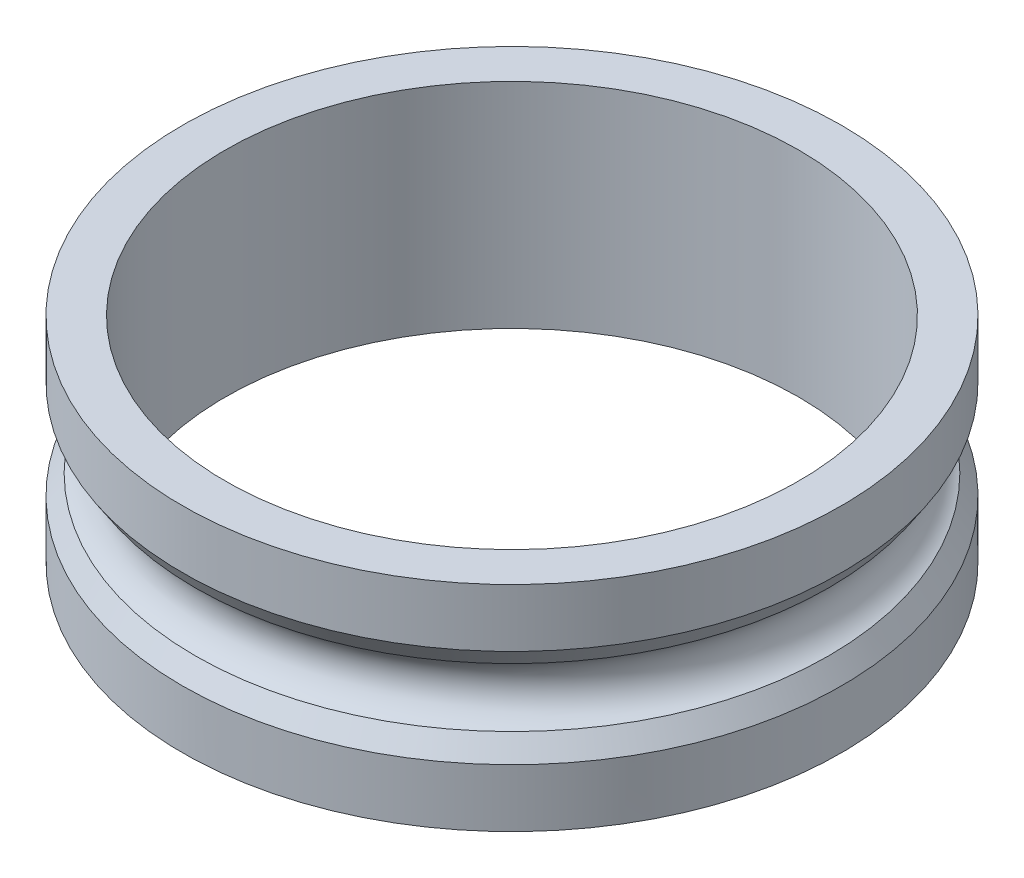
from build123d import *


with BuildPart() as part:
    # Sketch1 → Revolve1 (revolve)
    with BuildSketch(Plane.XY, mode=Mode.PRIVATE) as revolve1_sk:
        with BuildLine():
            Line((6.7, -2.5), (6.7, 2.5))
            Line((6.7, 2.5), (7.7, 2.5))
            Line((7.7, 2.5), (7.7, 0.75))
            ThreePointArc((7.7, 0.75), (6.95, 0), (7.7, -0.75))
            Line((7.7, -0.75), (7.7, -2.5))
            Line((7.7, -2.5), (6.7, -2.5))
        make_face()
    revolve(revolve1_sk.sketch.rotate(Axis((0, 0, 0), (0, 1, 0)), 90), axis=Axis((0, 0, 0), (0, 1, 0)))

    # Chamfer1
    # the kernel refuses this chamfer: 0.5 mm, written as the material it takes off along each edge
    with BuildSketch(Plane(origin=(0, -0.75, 0), x_dir=(0, 0, -1), z_dir=(1, 0, 0))) as chamfer1_piece_1:
        with BuildLine():
            Line((7.389045549, 0.079346846), (7.710954451, -0.412377124))
            Line((7.710954451, -0.412377124), (7.720954451, -0.412377124))
            ThreePointArc((7.720954451, -0.412377124), (7.71, -0.206188562), (7.71, 0))
            Line((7.71, 0), (7.7, 0.01))
            ThreePointArc((7.7, 0.01), (7.54177371, 0.027113812), (7.393045549, 0.088511998))
            Line((7.393045549, 0.088511998), (7.389045549, 0.079346846))
        make_face()
    revolve(axis=Axis((0, -0.75, 0), (0, 1, 0)), mode=Mode.SUBTRACT)
    with BuildSketch(Plane(origin=(0, 0.75, 0), x_dir=(0, 0, -1), z_dir=(1, 0, 0))) as chamfer1_piece_2:
        with BuildLine():
            Line((7.710954451, 0.412377124), (7.389045549, -0.079346846))
            Line((7.389045549, -0.079346846), (7.393045549, -0.088511998))
            ThreePointArc((7.393045549, -0.088511998), (7.54177371, -0.027113812), (7.7, -0.01))
            Line((7.7, -0.01), (7.71, 0))
            ThreePointArc((7.71, 0), (7.71, 0.206188562), (7.720954451, 0.412377124))
            Line((7.720954451, 0.412377124), (7.710954451, 0.412377124))
        make_face()
    revolve(axis=Axis((0, 0.75, 0), (0, 1, 0)), mode=Mode.SUBTRACT)


solid = part.part
